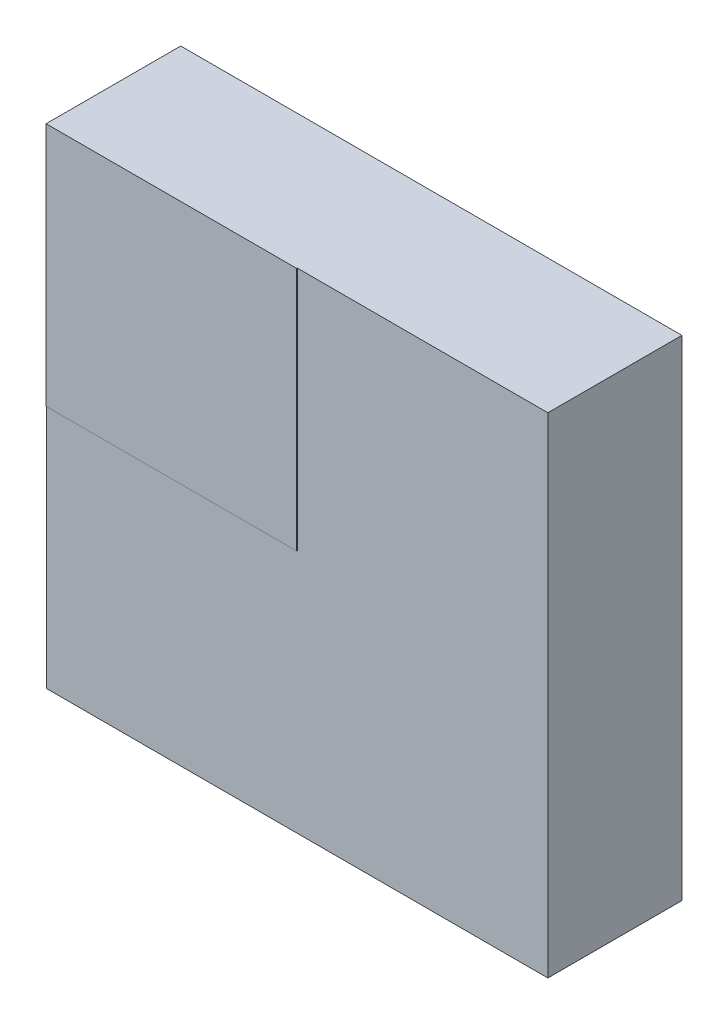
from build123d import *

# Parameters (mm, degrees)
SKETCH1_W                 = 0.86
SKETCH1_H                 = 0.84
BOSS_EXTRUDE1_DEPTH       = 0.23
SKETCH2_W                 = 0.43
SKETCH2_H                 = 0.42
BOSS_EXTRUDE2_DEPTH       = 0.001
SKETCH3_R                 = 0.09
BOSS_EXTRUDE3_DEPTH       = 0.1
FILLET1_SIZE              = 0.09
LPATTERN2_COUNT           = 2
LPATTERN2_PITCH           = 0.4
LPATTERN2_COUNT_DIR2      = 2
LPATTERN2_PITCH_DIR2      = 0.4
FILLET1_OF_LPATTERN2_SIZE = 0.09


with BuildPart() as part:
    # Sketch1 → Boss-Extrude1 (new body)
    with BuildSketch(Plane.XY):
        Rectangle(SKETCH1_W, SKETCH1_H)
    extrude(amount=BOSS_EXTRUDE1_DEPTH)

    # Sketch2 → Boss-Extrude2 (add)
    with BuildSketch(Plane.XY.offset(0.23)):
        with Locations((-0.215, 0.21)):
            Rectangle(SKETCH2_W, SKETCH2_H)
    extrude(amount=BOSS_EXTRUDE2_DEPTH)

    # Sketch3 → Boss-Extrude3 (add)
    with BuildSketch(Plane(origin=(0, 0, 0), x_dir=(-1, 0, 0), z_dir=(0, 0, -1))):
        with Locations((-0.2, 0.2)):
            Circle(SKETCH3_R)
    boss_extrude3 = extrude(amount=BOSS_EXTRUDE3_DEPTH)

    # Fillet1
    # a fillet whose section is not a circle: 0.09 mm, written as the material it takes off along each edge
    with BuildSketch(Plane(origin=(0.2, 0.2, -0.1), x_dir=(-1, 0, 0), z_dir=(0, -1, 0))) as fillet1_piece_1:
        with BuildLine():
            Bezier((0.09, -FILLET1_SIZE), (0.09, 0), (0.09 - FILLET1_SIZE, 0), weights=[1, 1, 1])
            Line((0.09 - FILLET1_SIZE, 0), (0.09, 0))
            Line((0.09, 0), (0.09, -FILLET1_SIZE))
        make_face()
    revolve(axis=Axis((0.2, 0.2, -0.1), (0, 0, -1)), mode=Mode.SUBTRACT)

    # LPattern2: Boss-Extrude3 2 × 2
    with Locations(*[(-i * LPATTERN2_PITCH, -j * LPATTERN2_PITCH_DIR2, 0) for i in range(LPATTERN2_COUNT) for j in range(LPATTERN2_COUNT_DIR2) if (i, j) != (0, 0)]):
        add(boss_extrude3)

    # Fillet1 of LPattern2
    # a fillet whose section is not a circle: 0.09 mm, written as the material it takes off along each edge
    with BuildSketch(Plane(origin=(0.2, -0.2, -0.1), x_dir=(-1, 0, 0), z_dir=(0, -1, 0))) as fillet1_of_lpattern2_piece_1:
        with BuildLine():
            Bezier((0.09, -FILLET1_OF_LPATTERN2_SIZE), (0.09, 0), (0.09 - FILLET1_OF_LPATTERN2_SIZE, 0), weights=[1, 1, 1])
            Line((0.09 - FILLET1_OF_LPATTERN2_SIZE, 0), (0.09, 0))
            Line((0.09, 0), (0.09, -FILLET1_OF_LPATTERN2_SIZE))
        make_face()
    revolve(axis=Axis((0.2, -0.2, -0.1), (0, 0, -1)), mode=Mode.SUBTRACT)
    with BuildSketch(Plane(origin=(-0.2, 0.2, -0.1), x_dir=(-1, 0, 0), z_dir=(0, -1, 0))) as fillet1_of_lpattern2_piece_2:
        with BuildLine():
            Bezier((0.09, -FILLET1_OF_LPATTERN2_SIZE), (0.09, 0), (0.09 - FILLET1_OF_LPATTERN2_SIZE, 0), weights=[1, 1, 1])
            Line((0.09 - FILLET1_OF_LPATTERN2_SIZE, 0), (0.09, 0))
            Line((0.09, 0), (0.09, -FILLET1_OF_LPATTERN2_SIZE))
        make_face()
    revolve(axis=Axis((-0.2, 0.2, -0.1), (0, 0, -1)), mode=Mode.SUBTRACT)
    with BuildSketch(Plane(origin=(-0.2, -0.2, -0.1), x_dir=(-1, 0, 0), z_dir=(0, -1, 0))) as fillet1_of_lpattern2_piece_3:
        with BuildLine():
            Bezier((0.09, -FILLET1_OF_LPATTERN2_SIZE), (0.09, 0), (0.09 - FILLET1_OF_LPATTERN2_SIZE, 0), weights=[1, 1, 1])
            Line((0.09 - FILLET1_OF_LPATTERN2_SIZE, 0), (0.09, 0))
            Line((0.09, 0), (0.09, -FILLET1_OF_LPATTERN2_SIZE))
        make_face()
    revolve(axis=Axis((-0.2, -0.2, -0.1), (0, 0, -1)), mode=Mode.SUBTRACT)


solid = part.part
